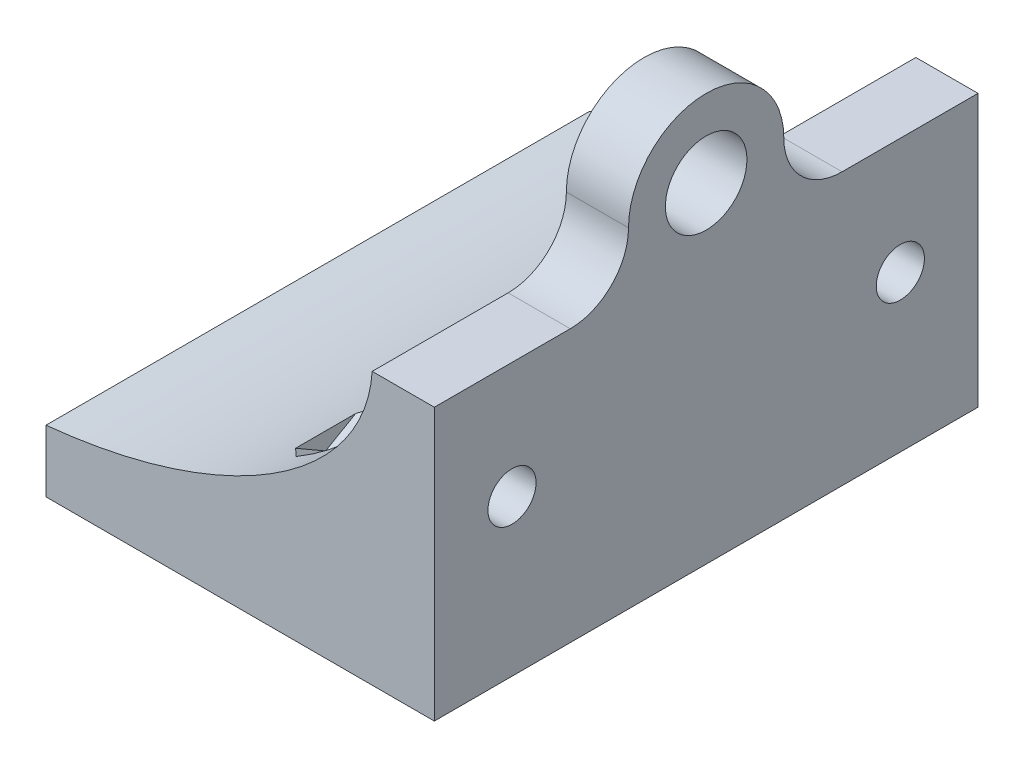
from build123d import *
from build123d.topology import SkipClean

# Parameters (mm, degrees)
RESSALTO_EXTRUS_O1_DEPTH = 70
CORTE_EXTRUS_O1_REACH    = 94.871
ESBO_O2_R                = 3.1
FILETE1_DEPTH            = 70
FILETE1_START            = -22
FILETE1_2_OUTLINE_R      = 3.1
FILETE1_2_DEPTH          = 14
ESBO_O3_R                = 5.25
RESSALTO_EXTRUS_O2_DEPTH = 8
CORTE_EXTRUS_O6_DEPTH    = 16


with BuildPart() as part:
    # Esboço1 → Ressalto-extrusão1 (new body)
    with BuildSketch(Plane.XY):
        Polygon((0, 0), (0, 35), (-8, 35), (-8, 8), (-50, 8), (-50, 0), align=None)
    extrude(amount=RESSALTO_EXTRUS_O1_DEPTH)

    # Esboço2 → Corte-extrusão1 (cut, up to next)
    with BuildSketch(Plane(origin=(0, 0, 0), x_dir=(0, 0, -1), z_dir=(1, 0, 0)), mode=Mode.PRIVATE) as corte_extrus_o1_sk1:
        with Locations((-60, 20.050946568)):
            Circle(ESBO_O2_R)
    corte_extrus_o1_tool1 = extrude(corte_extrus_o1_sk1.sketch, amount=-CORTE_EXTRUS_O1_REACH, mode=Mode.PRIVATE) & part.part
    # Esboço2 → Corte-extrusão1 (cut, up to next)
    with BuildSketch(Plane(origin=(0, 0, 0), x_dir=(0, 0, -1), z_dir=(1, 0, 0)), mode=Mode.PRIVATE) as corte_extrus_o1_sk2:
        with Locations((-10, 20.050946568)):
            Circle(ESBO_O2_R)
    corte_extrus_o1_tool2 = extrude(corte_extrus_o1_sk2.sketch, amount=-CORTE_EXTRUS_O1_REACH, mode=Mode.PRIVATE) & part.part
    add(corte_extrus_o1_tool1.solids().sort_by_distance((0, 20.050947, 60))[0], mode=Mode.SUBTRACT)
    add(corte_extrus_o1_tool2.solids().sort_by_distance((0, 20.050947, 10))[0], mode=Mode.SUBTRACT)

    # Filete1: read off the stored shape, not the designer's step
    # Filete1 outline → Filete1 (add)
    with BuildSketch(Plane.XY):
        with BuildLine():
            Line((-8, 8), (-8, 35))
            add(Edge.make_bspline(
                [(-8, 35), (-9.46726927, 11.949085531), (-50, 8)],
                knots=[0, 0, 0, 1, 1, 1], degree=2, weights=[1, 0.761577311, 1]))
            Line((-50, 8), (-8, 8))
        make_face()
    extrude(amount=FILETE1_DEPTH)

    # Filete1 2 outline → Filete1 2 (cut)
    with SkipClean():  # the faces are left unmerged after this step: merging them gives an invalid solid
        with BuildSketch(Plane.YZ.offset(FILETE1_START)):
            with Locations((20.050946568, 10)):
                Circle(FILETE1_2_OUTLINE_R)
            with Locations((20.050946568, 60)):
                Circle(FILETE1_2_OUTLINE_R)
        extrude(amount=FILETE1_2_DEPTH, mode=Mode.SUBTRACT)

    # Esboço3 → Ressalto-extrusão2 (add)
    with SkipClean():  # the faces are left unmerged after this step: merging them gives an invalid solid
        with BuildSketch(Plane(origin=(0, 0, 0), x_dir=(0, 0, -1), z_dir=(1, 0, 0))):
            with BuildLine():
                Line((-52.5, 35), (-17.5, 35))
                ThreePointArc((-17.5, 35), (-22.803300859, 37.196699141), (-25, 42.5))
                ThreePointArc((-25, 42.5), (-35, 52.5), (-45, 42.5))
                ThreePointArc((-45, 42.5), (-47.196699141, 37.196699141), (-52.5, 35))
            make_face()
            with Locations((-35, 42.5)):
                Circle(ESBO_O3_R, mode=Mode.SUBTRACT)
        extrude(amount=-RESSALTO_EXTRUS_O2_DEPTH)

    # Esboço6 → Corte-extrusão6 (cut)
    with BuildSketch(Plane.ZY.offset(8)):
        Polygon((4, 23.515048183), (4, 16.586844953), (10, 13.122743338), (16, 16.586844953), (16, 23.515048183), (10, 26.979149798), align=None)
        Polygon((54, 23.515048183), (54, 16.586844953), (60, 13.122743338), (66, 16.586844953), (66, 23.515048183), (60, 26.979149798), align=None)
    extrude(amount=CORTE_EXTRUS_O6_DEPTH, mode=Mode.SUBTRACT)


solid = part.part
